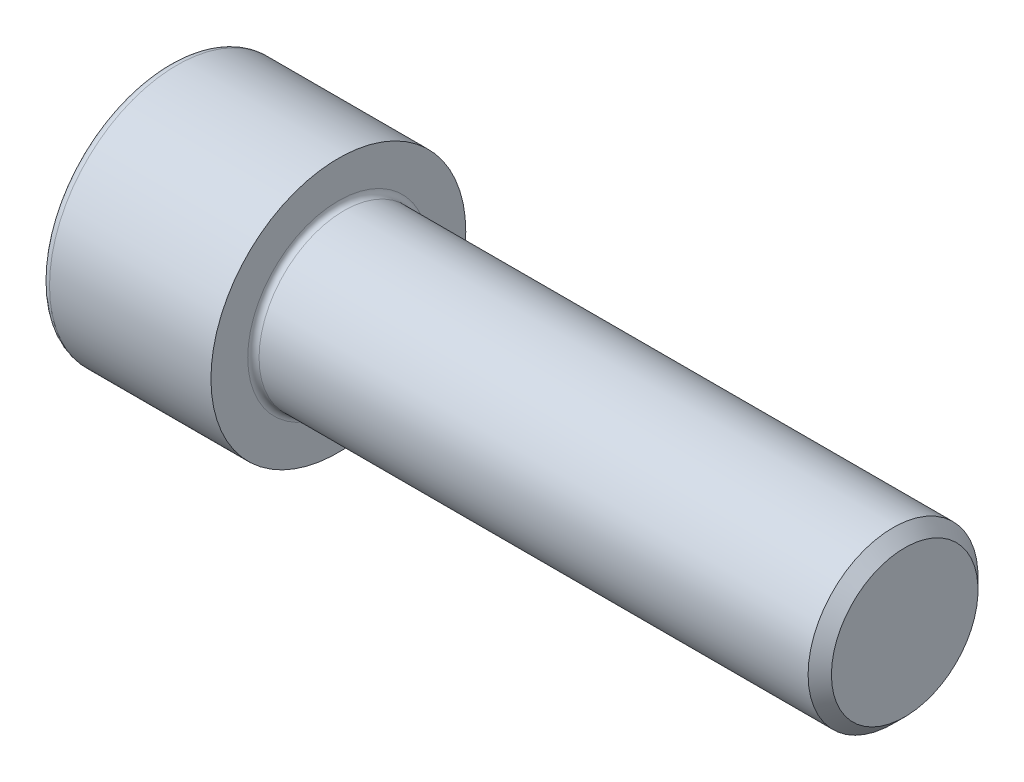
from build123d import *

# Parameters (mm, degrees)
FILLET1_R   = 0.8
FILLET2_R   = 1.2
HEX_2_DEPTH = 12.573


with BuildPart() as part:
    # BodySke → Base-Revolve (revolve)
    with BuildSketch(Plane.XY):
        Polygon((0, 0), (0, 18), (24, 18), (24, 12), (102.352, 12), (104, 10.352), (104, 0), align=None)
    revolve(axis=Axis((-31.75, 0, 0), (1, 0, 0)))

    # Fillet1
    fillet1_edges = [part.edges().sort_by_distance(p)[0] for p in [
        (24, -12, 0),
    ]]
    fillet(fillet1_edges, radius=FILLET1_R)

    # Fillet2
    fillet2_edges = [part.edges().sort_by_distance(p)[0] for p in [
        (0, -18, 0),
    ]]
    fillet(fillet2_edges, radius=FILLET2_R)

    # Sketch2 → Hex-PreBroach (revolve, cut)
    with BuildSketch(Plane.XY):
        Polygon((0, 9.6375), (12.573, 9.6375), (18.137213219, 0), (0, 0), align=None)
    revolve(axis=Axis((0, 0, 0), (1, 0, 0)), mode=Mode.SUBTRACT)

    # Sketch3 → Hex 2 (cut)
    with BuildSketch(Plane(origin=(0, 0, 0), x_dir=(0, 0.500000000000001, 0.866025403784438), z_dir=(-1, 0, 0))):
        Polygon((5.564213219, 9.6375), (-5.564213219, 9.6375), (-11.128426439, 0), (-5.564213219, -9.6375), (5.564213219, -9.6375), (11.128426439, 0), align=None)
    extrude(amount=-HEX_2_DEPTH, mode=Mode.SUBTRACT)


solid = part.part
